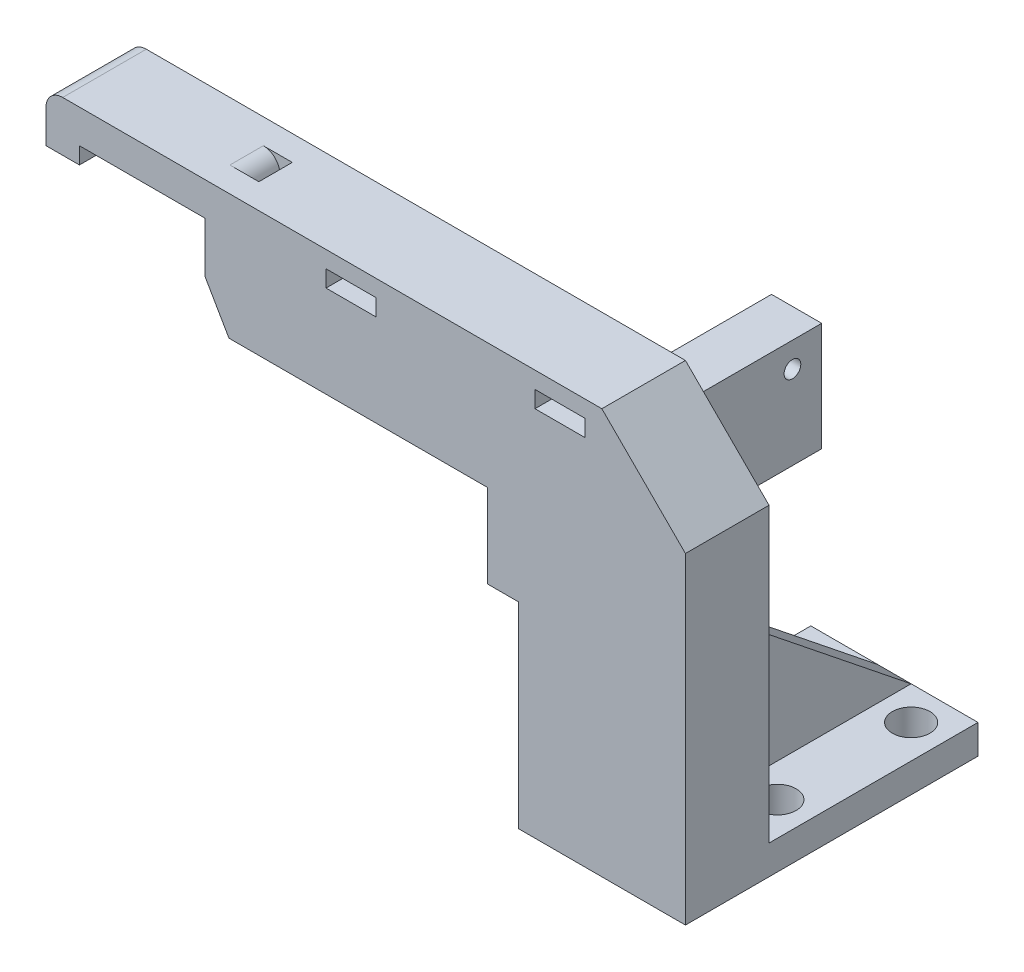
from build123d import *

# Parameters (mm, degrees)
BOSS_EXTRUDE1_DEPTH = 10
SKETCH6_W           = 20
SKETCH6_H           = 25
BOSS_EXTRUDE3_DEPTH = 3.5
SKETCH8_R           = 2.25
CUT_EXTRUDE2_DEPTH  = 47.313496953
SKETCH9_W           = 24
SKETCH9_H           = 13
BOSS_EXTRUDE4_DEPTH = 6
SKETCH10_R          = 1.1
CUT_EXTRUDE3_DEPTH  = 2
SKETCH11_R          = 1
CUT_EXTRUDE4_DEPTH  = 51.189042629
SKETCH12_W          = 6
SKETCH12_H          = 2
BOSS_EXTRUDE5_DEPTH = 10
SKETCH14_W          = 4
SKETCH14_H          = 2
CUT_EXTRUDE5_DEPTH  = 2
BOSS_EXTRUDE6_DEPTH = 2
FILLET1_R           = 2
CHAMFER1_SIZE       = 2
CHAMFER2_SIZE       = 10


with BuildPart() as part:
    # Sketch1 → Boss-Extrude1 (new body)
    with BuildSketch(Plane.XY):
        Polygon((-13.7, 36.5), (-13.7, 23.5), (-10, 23.5), (-10, 0), (10, 0), (10, 36.5), align=None)
    extrude(amount=BOSS_EXTRUDE1_DEPTH)

    # Sketch6 → Boss-Extrude3 (add)
    with BuildSketch(Plane.XZ):
        with Locations((0, -12.5)):
            Rectangle(SKETCH6_W, SKETCH6_H)
    extrude(amount=-BOSS_EXTRUDE3_DEPTH)

    # Sketch8 → Cut-Extrude2 (cut, through all)
    with BuildSketch(Plane.XZ):
        with Locations(Location((-6, -5, 0), (0, 0, 270))):
            Circle(SKETCH8_R)
        with Locations(Location((6, -5, 0), (0, 0, 270))):
            Circle(SKETCH8_R)
        with Locations(Location((6, -21, 0), (0, 0, 270))):
            Circle(SKETCH8_R)
        with Locations(Location((-6, -21, 0), (0, 0, 270))):
            Circle(SKETCH8_R)
    extrude(amount=-CUT_EXTRUDE2_DEPTH, mode=Mode.SUBTRACT)

    # Sketch9 → Boss-Extrude4 (add)
    with BuildSketch(Plane.ZY.offset(13.7)):
        with Locations((-12, 30)):
            Rectangle(SKETCH9_W, SKETCH9_H)
    extrude(amount=-BOSS_EXTRUDE4_DEPTH)

    # Sketch10 → Cut-Extrude3 (cut)
    with BuildSketch(Plane.ZY.offset(13.7)):
        with Locations((-13, 34.2)):
            Circle(SKETCH10_R)
        with Locations((-13, 27.8)):
            Circle(SKETCH10_R)
    extrude(amount=-CUT_EXTRUDE3_DEPTH, mode=Mode.SUBTRACT)

    # Sketch11 → Cut-Extrude4 (cut, through all)
    with BuildSketch(Plane.ZY.offset(13.7)):
        with Locations((-20.5, 33.5)):
            Circle(SKETCH11_R)
        with Locations((-5.5, 33.5)):
            Circle(SKETCH11_R)
    extrude(amount=-CUT_EXTRUDE4_DEPTH, mode=Mode.SUBTRACT)

    # Sketch12 → Boss-Extrude5 (add)
    with BuildSketch(Plane.XY.offset(10)):
        Polygon((10, 36.5), (-13.7, 36.5), (-13.7, 33.5), (-44.613248654, 33.5), (-47.5, 38.5), (-47.5, 44.5), (-62.5, 44.5), (-62.5, 42.5), (-66.5, 42.5), (-66.5, 48.5), (10, 48.5), align=None)
        with Locations((-30, 45.5)):
            Rectangle(SKETCH12_W, SKETCH12_H, mode=Mode.SUBTRACT)
        with Locations((-5, 45.5)):
            Rectangle(SKETCH12_W, SKETCH12_H, mode=Mode.SUBTRACT)
    extrude(amount=-BOSS_EXTRUDE5_DEPTH)

    # Sketch14 → Cut-Extrude5 (cut, symmetric)
    with BuildSketch(Plane.XY.offset(5)):
        with Locations((-64.5, 43.5)):
            Rectangle(SKETCH14_W, SKETCH14_H)
        with BuildLine():
            Line((-47.5, 44.5), (-47.5, 42.5))
            ThreePointArc((-47.5, 42.5), (-44.035898385, 44.5), (-44.035898385, 48.5))
            Line((-44.035898385, 48.5), (-47.5, 48.5))
            ThreePointArc((-47.5, 48.5), (-45.5, 46.5), (-47.5, 44.5))
        make_face()
    extrude(amount=CUT_EXTRUDE5_DEPTH, both=True, mode=Mode.SUBTRACT)

    # Sketch15 → Boss-Extrude6 (add, symmetric)
    with BuildSketch(Plane(origin=(0, 0, 0), x_dir=(0, 0, -1), z_dir=(1, 0, 0))):
        Polygon((0, 3.5), (25, 3.5), (0, 23.5), align=None)
    extrude(amount=BOSS_EXTRUDE6_DEPTH, both=True)

    # Fillet1
    fillet1_edges = [part.edges().sort_by_distance(p)[0] for p in [
        (-66.5, 44.5, 5),
        (-66.5, 48.5, 5),
    ]]
    fillet(fillet1_edges, radius=FILLET1_R - 0.0001)  # a hair under: the kernel refuses the full size

    # Chamfer1
    chamfer1_edges = [part.edges().sort_by_distance(p)[0] for p in [
        (-64.5, 42.5, 3),
    ]]
    chamfer(chamfer1_edges, length=CHAMFER1_SIZE - 0.0001)  # a hair under: the kernel refuses the full size

    # Chamfer2
    chamfer2_edges = [part.edges().sort_by_distance(p)[0] for p in [
        (10, 48.5, 5),
    ]]
    chamfer(chamfer2_edges, length=CHAMFER2_SIZE)


solid = part.part
